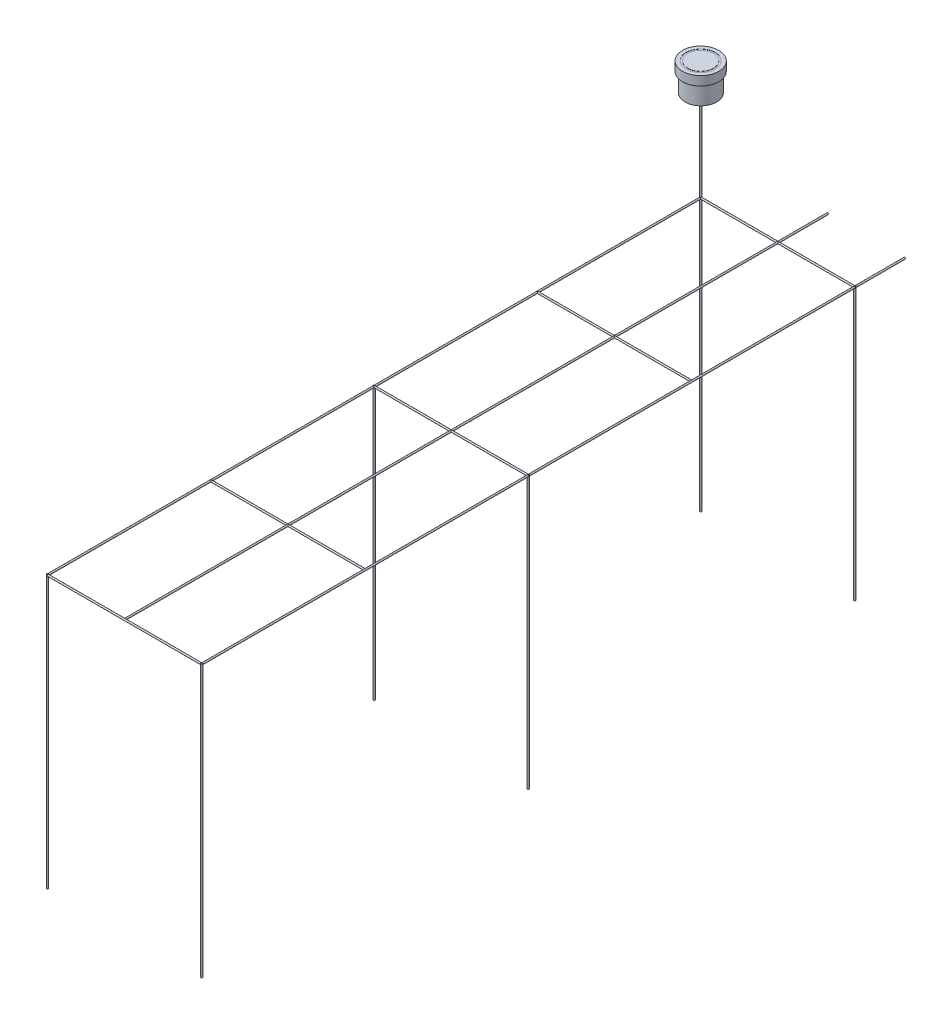
from build123d import *
from build123d.topology import SkipClean

# Parameters (mm, degrees)
CROQUIS1_R               = 9
SALIENTE_EXTRUIR1_DEPTH  = 3000
CROQUIS2_R               = 9
SALIENTE_EXTRUIR2_DEPTH  = 7200
MATRIZL2_COUNT           = 3
MATRIZL2_PITCH           = 3600
CROQUIS3_R               = 9
SALIENTE_EXTRUIR3_DEPTH  = 1700
MATRIZL3_COUNT           = 2
MATRIZL3_PITCH           = 1700
SALIENTE_EXTRUIR5_START  = 1300
CROQUIS6_R               = 9
SALIENTE_EXTRUIR5_DEPTH  = 1300
CROQUIS7_R               = 200
SALIENTE_EXTRUIR6_DEPTH  = 100
CROQUIS8_R               = 175
SALIENTE_EXTRUIR7_DEPTH  = 200
CROQUIS12_R              = 9
SALIENTE_EXTRUIR8_DEPTH  = 7200
MATRIZL4_COUNT           = 3
MATRIZL4_PITCH           = 3600
CROQUIS13_R              = 9
SALIENTE_EXTRUIR10_DEPTH = 3000
CROQUIS15_R              = 9
SALIENTE_EXTRUIR11_DEPTH = 550
CROQUIS17_R              = 9
SALIENTE_EXTRUIR12_DEPTH = 7201
CROQUIS18_R              = 9
SALIENTE_EXTRUIR14_DEPTH = 1700
CROQUIS19_R              = 160
CROQUIS19_R_2            = 141.619429307
CORTAR_EXTRUIR1_DEPTH    = 2
CROQUIS20_R              = 9
SALIENTE_EXTRUIR15_DEPTH = 550


with BuildPart() as part:
    # Croquis1 → Saliente-Extruir1 (new body)
    with BuildSketch(Plane(origin=(0, 0, 0), x_dir=(1, 0, 0), z_dir=(0, 1, 0))):
        Circle(CROQUIS1_R)
    saliente_extruir1 = extrude(amount=-SALIENTE_EXTRUIR1_DEPTH)

    # Croquis2 → Saliente-Extruir2 (add)
    with BuildSketch(Plane.XY):
        with Locations((0, -9)):
            Circle(CROQUIS2_R)
    extrude(amount=-SALIENTE_EXTRUIR2_DEPTH)

    # MatrizL2: Saliente-Extruir1 ×3
    with Locations(*[(0, 0, -i * MATRIZL2_PITCH) for i in range(1, MATRIZL2_COUNT)]):
        add(saliente_extruir1)

    # Croquis3 → Saliente-Extruir3 (add)
    with BuildSketch(Plane(origin=(0, 0, 0), x_dir=(0, 0, -1), z_dir=(1, 0, 0))):
        with Locations((0, -9)):
            Circle(CROQUIS3_R)
    saliente_extruir3 = extrude(amount=SALIENTE_EXTRUIR3_DEPTH)

    # MatrizL3: Saliente-Extruir1 ×2
    with Locations(*[(i * MATRIZL3_PITCH, 0, 0) for i in range(1, MATRIZL3_COUNT)]):
        add(saliente_extruir1)

    # Croquis6 → Saliente-Extruir5 (add)
    with BuildSketch(Plane(origin=(0, 0, 0), x_dir=(1, 0, 0), z_dir=(0, 1, 0)).offset(SALIENTE_EXTRUIR5_START)):
        with Locations((0, 7200)):
            Circle(CROQUIS6_R)
    extrude(amount=-SALIENTE_EXTRUIR5_DEPTH)

    # Croquis7 → Saliente-Extruir6 (add)
    with BuildSketch(Plane(origin=(0, 1300, 0), x_dir=(1, 0, 0), z_dir=(0, 1, 0))):
        with Locations((0, 7200)):
            Circle(CROQUIS7_R)
    extrude(amount=-SALIENTE_EXTRUIR6_DEPTH)

    # Croquis8 → Saliente-Extruir7 (add)
    with BuildSketch(Plane.XZ.offset(-1200)):
        with Locations((7.481952141, -7194.997961199)):
            Circle(CROQUIS8_R)
    extrude(amount=SALIENTE_EXTRUIR7_DEPTH)

    # Croquis12 → Saliente-Extruir8 (add)
    with SkipClean():  # the faces are left unmerged after this step: merging them gives an invalid solid
        with BuildSketch(Plane(origin=(0, 0, 0), x_dir=(-1, 0, 0), z_dir=(0, 0, -1))):
            with Locations((-1700, -9)):
                Circle(CROQUIS12_R)
        extrude(amount=SALIENTE_EXTRUIR8_DEPTH)

    # MatrizL4: Saliente-Extruir3 ×3
    with SkipClean():  # the faces are left unmerged after this step: merging them gives an invalid solid
        with Locations(*[(0, 0, -i * MATRIZL4_PITCH) for i in range(1, MATRIZL4_COUNT)]):
            add(saliente_extruir3)

    # Croquis13 → Saliente-Extruir10 (add)
    with SkipClean():  # the faces are left unmerged after this step: merging them gives an invalid solid
        with BuildSketch(Plane(origin=(0, 0, 0), x_dir=(1, 0, 0), z_dir=(0, 1, 0))):
            with Locations((0, 3600)):
                Circle(CROQUIS13_R)
            with Locations((1700, 3600)):
                Circle(CROQUIS13_R)
            with Locations((1700, 7200)):
                Circle(CROQUIS13_R)
        extrude(amount=-SALIENTE_EXTRUIR10_DEPTH)

    # Croquis15 → Saliente-Extruir11 (add)
    with SkipClean():  # the faces are left unmerged after this step: merging them gives an invalid solid
        with BuildSketch(Plane(origin=(0, 0, -7200), x_dir=(-1, 0, 0), z_dir=(0, 0, -1))):
            with Locations((-1700, -9)):
                Circle(CROQUIS15_R)
        extrude(amount=SALIENTE_EXTRUIR11_DEPTH)

    # Croquis17 → Saliente-Extruir12 (add)
    with SkipClean():  # the faces are left unmerged after this step: merging them gives an invalid solid
        with BuildSketch(Plane(origin=(0, 0, 0), x_dir=(-1, 0, 0), z_dir=(0, 0, -1))):
            with Locations((-850, -9)):
                Circle(CROQUIS17_R)
        extrude(amount=SALIENTE_EXTRUIR12_DEPTH)

    # Croquis18 → Saliente-Extruir14 (add)
    with SkipClean():  # the faces are left unmerged after this step: merging them gives an invalid solid
        with BuildSketch(Plane(origin=(0, 0, 0), x_dir=(0, 0, -1), z_dir=(1, 0, 0))):
            with Locations((1800, -9)):
                Circle(CROQUIS18_R)
            with Locations((5400, -9)):
                Circle(CROQUIS18_R)
        extrude(amount=SALIENTE_EXTRUIR14_DEPTH)

    # Croquis19 → Cortar-Extruir1 (cut)
    with SkipClean():  # the faces are left unmerged after this step: merging them gives an invalid solid
        with BuildSketch(Plane(origin=(0, 1300, 0), x_dir=(1, 0, 0), z_dir=(0, 1, 0))):
            with Locations((0, 7200)):
                Circle(CROQUIS19_R)
            with Locations((0, 7200)):
                Circle(CROQUIS19_R_2, mode=Mode.SUBTRACT)
        extrude(amount=-CORTAR_EXTRUIR1_DEPTH, mode=Mode.SUBTRACT)

    # Croquis20 → Saliente-Extruir15 (add)
    with SkipClean():  # the faces are left unmerged after this step: merging them gives an invalid solid
        with BuildSketch(Plane(origin=(0, 0, -7200), x_dir=(-1, 0, 0), z_dir=(0, 0, -1))):
            with Locations((-850, -9)):
                Circle(CROQUIS20_R)
        extrude(amount=SALIENTE_EXTRUIR15_DEPTH)


solid = part.part
